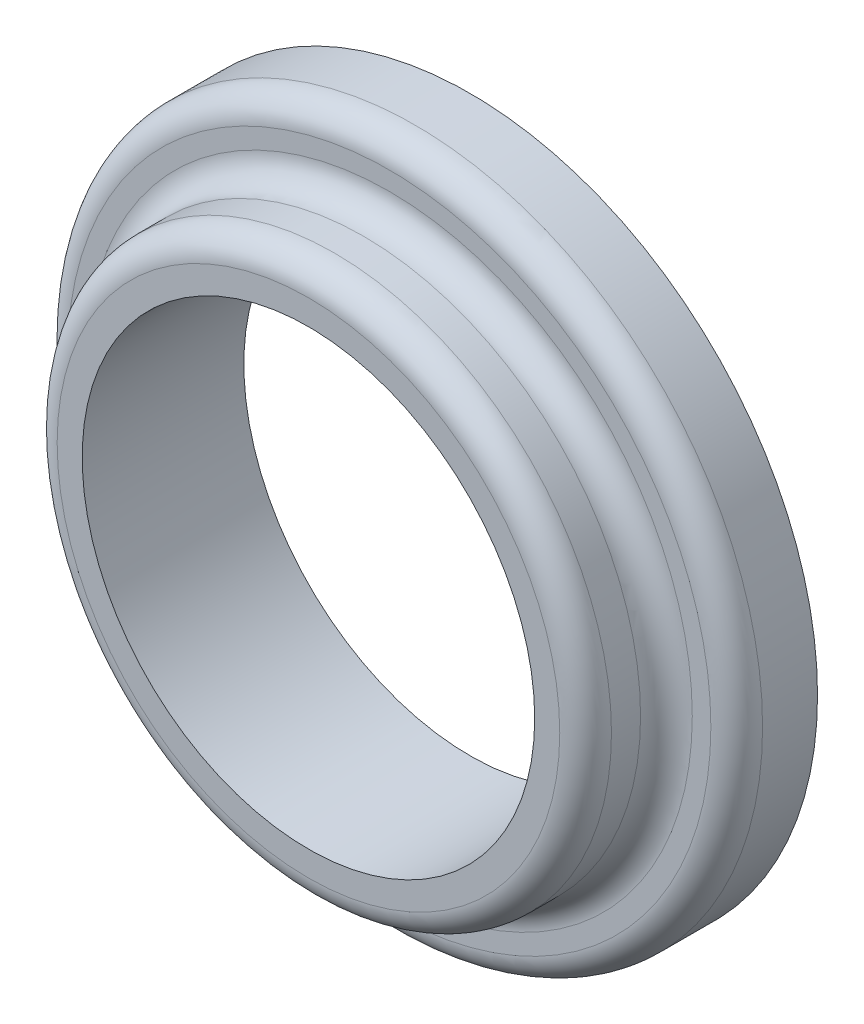
from build123d import *

# Parameters (mm, degrees)
SKETCH1_R           = 6.82625
SKETCH1_R_2         = 4.445
BOSS_EXTRUDE1_DEPTH = 1.5875
SKETCH2_R           = 5.445
SKETCH2_R_2         = 4.445
EXTRUDE_THIN1_DEPTH = 1.5875
FILLET1_R           = 0.508


with BuildPart() as part:
    # Sketch1 → Boss-Extrude1 (new body)
    with BuildSketch(Plane.XY):
        with Locations((-6.731, -165.7192297)):
            Circle(SKETCH1_R)
        with Locations((-6.731, -165.7192297)):
            Circle(SKETCH1_R_2, mode=Mode.SUBTRACT)
    extrude(amount=BOSS_EXTRUDE1_DEPTH)

    # Sketch2 → Extrude-Thin1 (add)
    with BuildSketch(Plane.XY.offset(1.5875)):
        with Locations((-6.731, -165.7192297)):
            Circle(SKETCH2_R)
        with Locations((-6.731, -165.7192297)):
            Circle(SKETCH2_R_2, mode=Mode.SUBTRACT)
    extrude(amount=EXTRUDE_THIN1_DEPTH)

    # Fillet1
    fillet1_edges = [part.edges().sort_by_distance(p)[0] for p in [
        (-13.55725, -165.7192297, 1.5875),
        (-12.176, -165.7192297, 1.5875),
        (-12.176, -165.7192297, 3.175),
    ]]
    fillet(fillet1_edges, radius=FILLET1_R)


solid = part.part
